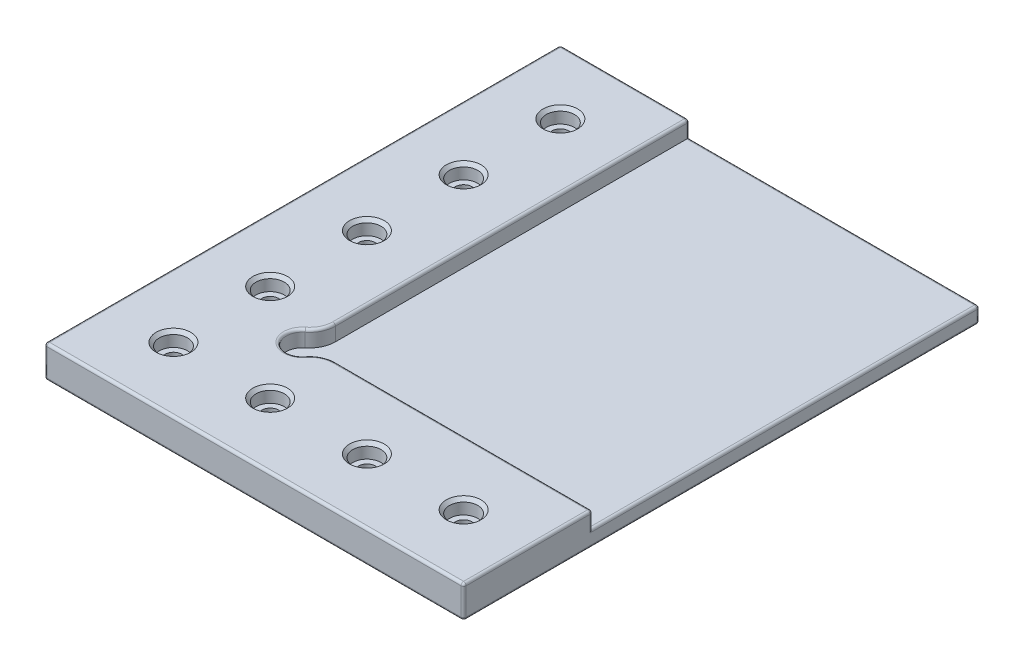
from build123d import *

# Parameters (mm, degrees)
BASE_PLATE_W                    = 82.55
BASE_PLATE_H                    = 101.6
MAIN_BODY_DEPTH                 = 6.35
MOUNTING_HOLES_CBORE_AT_2_COUNT = 2
MOUNTING_HOLES_CBORE_AT_2_PITCH = 19.05
MOUNTING_HOLES_CBORE_AT_3_COUNT = 2
MOUNTING_HOLES_CBORE_AT_3_PITCH = 38.1
MOUNTING_HOLES_CBORE_AT_4_COUNT = 2
MOUNTING_HOLES_CBORE_AT_4_PITCH = 57.15
MOUNTING_HOLES_CBORE_AT_5_COUNT = 2
MOUNTING_HOLES_CBORE_AT_5_PITCH = 19.05
MOUNTING_HOLES_CBORE_AT_6_COUNT = 2
MOUNTING_HOLES_CBORE_AT_6_PITCH = 38.1
MOUNTING_HOLES_CBORE_AT_7_COUNT = 2
MOUNTING_HOLES_CBORE_AT_7_PITCH = 57.15
MOUNTING_HOLES_CBORE_AT_8_COUNT = 2
MOUNTING_HOLES_CBORE_AT_8_PITCH = 76.2
L_AREA_EXCLUSION_W              = 57.15
L_AREA_EXCLUSION_H              = 76.2
L_AREA_STEP_CUT_DEPTH           = 3.175
RELIEF_CIRCLE_SKETCH_R          = 3.175
SUBSTRATE_RELIEF_POCKET_DEPTH   = 3.175
RELIEF_CIRCLE_CORNER_BLEND_R    = 5.08
OUTER_EDGE_SOFTENING_R          = 0.508


with BuildPart() as part:
    # Base Plate → Main Body (new body)
    with BuildSketch(Plane(origin=(0, 0, 0), x_dir=(1, 0, 0), z_dir=(0, 1, 0))):
        Rectangle(BASE_PLATE_W, BASE_PLATE_H)
    extrude(amount=MAIN_BODY_DEPTH)

    # Hole Profile → Mounting Holes _CBORE (revolve, cut)
    with BuildSketch(Plane(origin=(-28.575, 6.35, 38.1), x_dir=(0, 0, 1), z_dir=(1, 0, 0))):
        Polygon((0, 0), (0, 6.35), (1.63195, 6.35), (1.63195, 2.8448), (2.77876, 2.8448), (2.77876, 0.635), (3.41376, 0), align=None)
    mounting_holes_cbore = revolve(axis=Axis((-28.575, 12.7, 38.1), (0, -1, 0)), mode=Mode.SUBTRACT)

    # Mounting Holes _CBORE at 2: Mounting Holes _CBORE ×2
    with Locations(*[(i * MOUNTING_HOLES_CBORE_AT_2_PITCH, 0, 0) for i in range(1, MOUNTING_HOLES_CBORE_AT_2_COUNT)]):
        add(mounting_holes_cbore, mode=Mode.SUBTRACT)

    # Mounting Holes _CBORE at 3: Mounting Holes _CBORE ×2
    with Locations(*[(i * MOUNTING_HOLES_CBORE_AT_3_PITCH, 0, 0) for i in range(1, MOUNTING_HOLES_CBORE_AT_3_COUNT)]):
        add(mounting_holes_cbore, mode=Mode.SUBTRACT)

    # Mounting Holes _CBORE at 4: Mounting Holes _CBORE ×2
    with Locations(*[(i * MOUNTING_HOLES_CBORE_AT_4_PITCH, 0, 0) for i in range(1, MOUNTING_HOLES_CBORE_AT_4_COUNT)]):
        add(mounting_holes_cbore, mode=Mode.SUBTRACT)

    # Mounting Holes _CBORE at 5: Mounting Holes _CBORE ×2
    with Locations(*[(0, 0, -i * MOUNTING_HOLES_CBORE_AT_5_PITCH) for i in range(1, MOUNTING_HOLES_CBORE_AT_5_COUNT)]):
        add(mounting_holes_cbore, mode=Mode.SUBTRACT)

    # Mounting Holes _CBORE at 6: Mounting Holes _CBORE ×2
    with Locations(*[(0, 0, -i * MOUNTING_HOLES_CBORE_AT_6_PITCH) for i in range(1, MOUNTING_HOLES_CBORE_AT_6_COUNT)]):
        add(mounting_holes_cbore, mode=Mode.SUBTRACT)

    # Mounting Holes _CBORE at 7: Mounting Holes _CBORE ×2
    with Locations(*[(0, 0, -i * MOUNTING_HOLES_CBORE_AT_7_PITCH) for i in range(1, MOUNTING_HOLES_CBORE_AT_7_COUNT)]):
        add(mounting_holes_cbore, mode=Mode.SUBTRACT)

    # Mounting Holes _CBORE at 8: Mounting Holes _CBORE ×2
    with Locations(*[(0, 0, -i * MOUNTING_HOLES_CBORE_AT_8_PITCH) for i in range(1, MOUNTING_HOLES_CBORE_AT_8_COUNT)]):
        add(mounting_holes_cbore, mode=Mode.SUBTRACT)

    # L-Area Exclusion → L-Area Step Cut (cut)
    with BuildSketch(Plane(origin=(0, 6.35, 0), x_dir=(1, 0, 0), z_dir=(0, 1, 0))):
        with Locations((12.7, 12.7)):
            Rectangle(L_AREA_EXCLUSION_W, L_AREA_EXCLUSION_H)
    extrude(amount=-L_AREA_STEP_CUT_DEPTH, mode=Mode.SUBTRACT)

    # Relief Circle Sketch → Substrate Relief Pocket (cut)
    with BuildSketch(Plane(origin=(0, 6.35, 0), x_dir=(1, 0, 0), z_dir=(0, 1, 0))):
        with Locations((-15.875, -25.4)):
            Circle(RELIEF_CIRCLE_SKETCH_R)
    extrude(amount=-SUBSTRATE_RELIEF_POCKET_DEPTH, mode=Mode.SUBTRACT)

    # Relief Circle Corner Blend
    relief_circle_corner_blend_edges = [part.edges().sort_by_distance(p)[0] for p in [
        (-12.7, 4.7625, 25.4),
        (-15.875, 4.7625, 22.225),
    ]]
    fillet(relief_circle_corner_blend_edges, radius=RELIEF_CIRCLE_CORNER_BLEND_R)

    # Outer Edge Softening
    outer_edge_softening_edges = [part.edges().sort_by_distance(p)[0] for p in [
        (15.953406868, 6.35, 25.4),
        (-11.595913633, 6.35, 25.914517466),
        (-18.12006403, 6.35, 27.64506403),
        (-16.389517466, 6.35, 21.120913633),
        (41.275, 6.35, 38.1),
        (-41.275, 0, 0),
        (0, 0, 50.8),
        (0, 6.35, 50.8),
        (-15.875, 6.35, -15.953406868),
        (-41.275, 6.35, 0),
        (0, 0, -50.8),
        (-15.875, 4.7625, -50.8),
        (-28.575, 6.35, -50.8),
        (12.7, 3.175, -50.8),
        (41.275, 0, 0),
        (41.275, 3.175, -12.7),
        (41.275, 4.7625, 25.4),
        (41.275, 3.175, 50.8),
        (41.275, 1.5875, -50.8),
        (-41.275, 3.175, -50.8),
        (-41.275, 3.175, 50.8),
    ]]
    fillet(outer_edge_softening_edges, radius=OUTER_EDGE_SOFTENING_R)


solid = part.part
